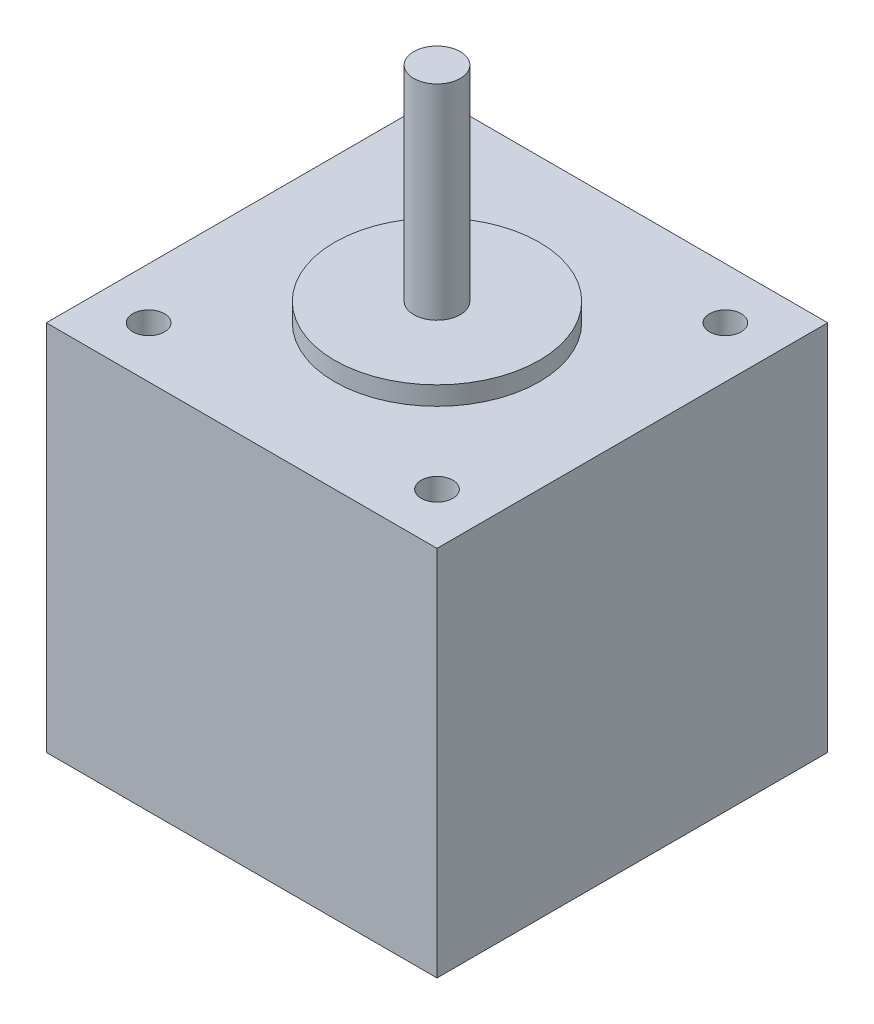
from build123d import *

# Parameters (mm, degrees)
SKETCH1_W           = 42
SKETCH1_H           = 42
BOSS_EXTRUDE1_DEPTH = 40
SKETCH4_R           = 1.6999966
CUT_EXTRUDE1_DEPTH  = 4.5
SKETCH2_R           = 11
BOSS_EXTRUDE2_DEPTH = 2
SKETCH3_R           = 2.5
BOSS_EXTRUDE3_DEPTH = 22


with BuildPart() as part:
    # Sketch1 → Boss-Extrude1 (new body)
    with BuildSketch(Plane(origin=(0, 0, 0), x_dir=(1, 0, 0), z_dir=(0, 1, 0))):
        Rectangle(SKETCH1_W, SKETCH1_H)
    extrude(amount=BOSS_EXTRUDE1_DEPTH)

    # Sketch4 → Cut-Extrude1 (cut)
    with BuildSketch(Plane(origin=(0, 40, 0), x_dir=(1, 0, 0), z_dir=(0, 1, 0))):
        with Locations((-15.5, 15.5)):
            Circle(SKETCH4_R)
        with Locations((15.5, 15.5)):
            Circle(SKETCH4_R)
        with Locations((-15.5, -15.5)):
            Circle(SKETCH4_R)
        with Locations((15.5, -15.5)):
            Circle(SKETCH4_R)
    extrude(amount=-CUT_EXTRUDE1_DEPTH, mode=Mode.SUBTRACT)

    # Sketch2 → Boss-Extrude2 (add)
    with BuildSketch(Plane(origin=(0, 40, 0), x_dir=(1, 0, 0), z_dir=(0, 1, 0))):
        Circle(SKETCH2_R)
    extrude(amount=BOSS_EXTRUDE2_DEPTH)

    # Sketch3 → Boss-Extrude3 (add)
    with BuildSketch(Plane(origin=(0, 42, 0), x_dir=(1, 0, 0), z_dir=(0, 1, 0))):
        Circle(SKETCH3_R)
    extrude(amount=BOSS_EXTRUDE3_DEPTH)


solid = part.part
